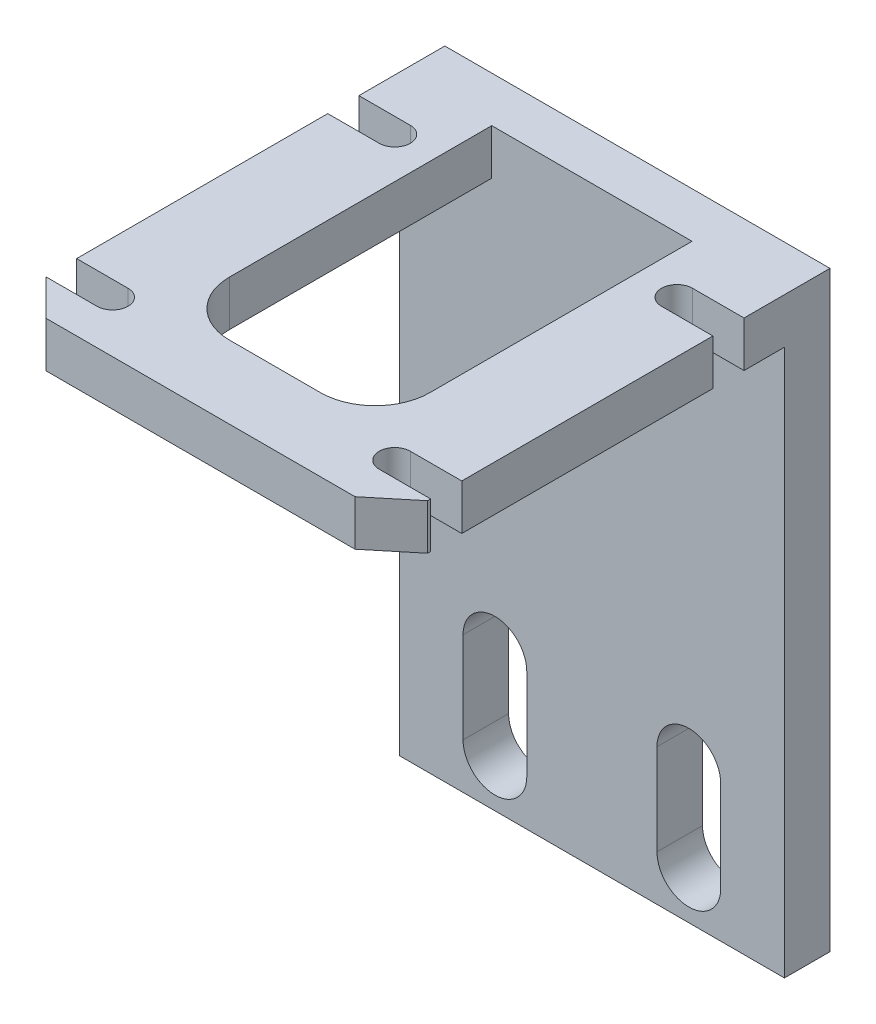
from build123d import *

# Parameters (mm, degrees)
BOSS_EXTRUDE1_DEPTH = 5
CUT_EXTRUDE1_DEPTH  = 49.34188322
FILLET1_R           = 6
CUT_EXTRUDE2_DEPTH  = 49.34188322
BOSS_EXTRUDE4_DEPTH = 65
CUT_EXTRUDE4_DEPTH  = 77.884446541


with BuildPart() as part:
    # Sketch1 → Boss-Extrude1 (new body)
    with BuildSketch(Plane(origin=(0, 0, 0), x_dir=(1, 0, 0), z_dir=(0, 1, 0))):
        Polygon((-10.255294708, 3.008405172), (11.744705292, 3.008405172), (11.744705292, 42.808405172), (21.894705292, 42.808405172), (21.894705292, 3.008405172), (21.894705292, -4.991594828), (-20.405294708, -4.991594828), (-20.405294708, 3.008405172), (-20.405294708, 42.808405172), (-10.255294708, 42.808405172), align=None)
    extrude(amount=BOSS_EXTRUDE1_DEPTH)

    # Sketch2 → Cut-Extrude1 (cut, through all)
    with BuildSketch(Plane.XZ):
        with BuildLine():
            Line((-20.405294708, -33.368405172), (-14.755294708, -33.368405172))
            ThreePointArc((-14.755294708, -33.368405172), (-13.045294708, -31.658405172), (-14.755294708, -29.948405172))
            Line((-14.755294708, -29.948405172), (-20.405294708, -29.948405172))
            Line((-20.405294708, -29.948405172), (-20.405294708, -33.368405172))
        make_face()
        with BuildLine():
            Line((-20.405294708, -2.368405172), (-14.755294708, -2.368405172))
            ThreePointArc((-14.755294708, -2.368405172), (-13.045294708, -0.658405172), (-14.755294708, 1.051594828))
            Line((-14.755294708, 1.051594828), (-20.405294708, 1.051594828))
            Line((-20.405294708, 1.051594828), (-20.405294708, -2.368405172))
        make_face()
        with BuildLine():
            Line((21.894705292, 1.051594828), (16.244705292, 1.051594828))
            ThreePointArc((16.244705292, 1.051594828), (14.534705292, -0.658405172), (16.244705292, -2.368405172))
            Line((16.244705292, -2.368405172), (21.894705292, -2.368405172))
            Line((21.894705292, -2.368405172), (21.894705292, 1.051594828))
        make_face()
        with BuildLine():
            Line((21.894705292, -29.948405172), (16.244705292, -29.948405172))
            ThreePointArc((16.244705292, -29.948405172), (14.534705292, -31.658405172), (16.244705292, -33.368405172))
            Line((16.244705292, -33.368405172), (21.894705292, -33.368405172))
            Line((21.894705292, -33.368405172), (21.894705292, -29.948405172))
        make_face()
    extrude(amount=-CUT_EXTRUDE1_DEPTH, mode=Mode.SUBTRACT)

    # Fillet1
    fillet1_edges = [part.edges().sort_by_distance(p)[0] for p in [
        (-10.255294708, 2.5, -3.008405172),
        (11.744705292, 2.5, -3.008405172),
    ]]
    fillet(fillet1_edges, radius=FILLET1_R)

    # Sketch3 → Cut-Extrude2 (cut, through all)
    with BuildSketch(Plane.XZ):
        Polygon((21.894705292, 1.391259285), (17.527419638, 4.991594828), (21.894705292, 4.991594828), align=None)
        Polygon((-20.405294708, 0.994660971), (-16.397786785, 4.991594828), (-20.405294708, 4.991594828), align=None)
    extrude(amount=-CUT_EXTRUDE2_DEPTH, mode=Mode.SUBTRACT)

    # Sketch5 → Boss-Extrude4 (add)
    with BuildSketch(Plane(origin=(0, 5, 0), x_dir=(1, 0, 0), z_dir=(0, 1, 0))):
        Polygon((21.894705292, 42.808405172), (-10.255294708, 42.808405172), (-20.405294708, 42.808405172), (-20.405294708, 37.808405172), (-10.255294708, 37.808405172), (21.894705292, 37.808405172), align=None)
    extrude(amount=-BOSS_EXTRUDE4_DEPTH)

    # Sketch7 → Cut-Extrude4 (cut, through all)
    with BuildSketch(Plane.XY.offset(-37.808405172)):
        with BuildLine():
            Line((-6.405294708, -45), (-6.405294708, -55))
            ThreePointArc((-6.405294708, -55), (-9.905294708, -58.5), (-13.405294708, -55))
            Line((-13.405294708, -55), (-13.405294708, -45))
            ThreePointArc((-13.405294708, -45), (-9.905294708, -41.5), (-6.405294708, -45))
        make_face()
        with BuildLine():
            Line((14.894705292, -45), (14.894705292, -55))
            ThreePointArc((14.894705292, -55), (11.394705292, -58.5), (7.894705292, -55))
            Line((7.894705292, -55), (7.894705292, -45))
            ThreePointArc((7.894705292, -45), (11.394705292, -41.5), (14.894705292, -45))
        make_face()
    extrude(amount=-CUT_EXTRUDE4_DEPTH, mode=Mode.SUBTRACT)


solid = part.part
